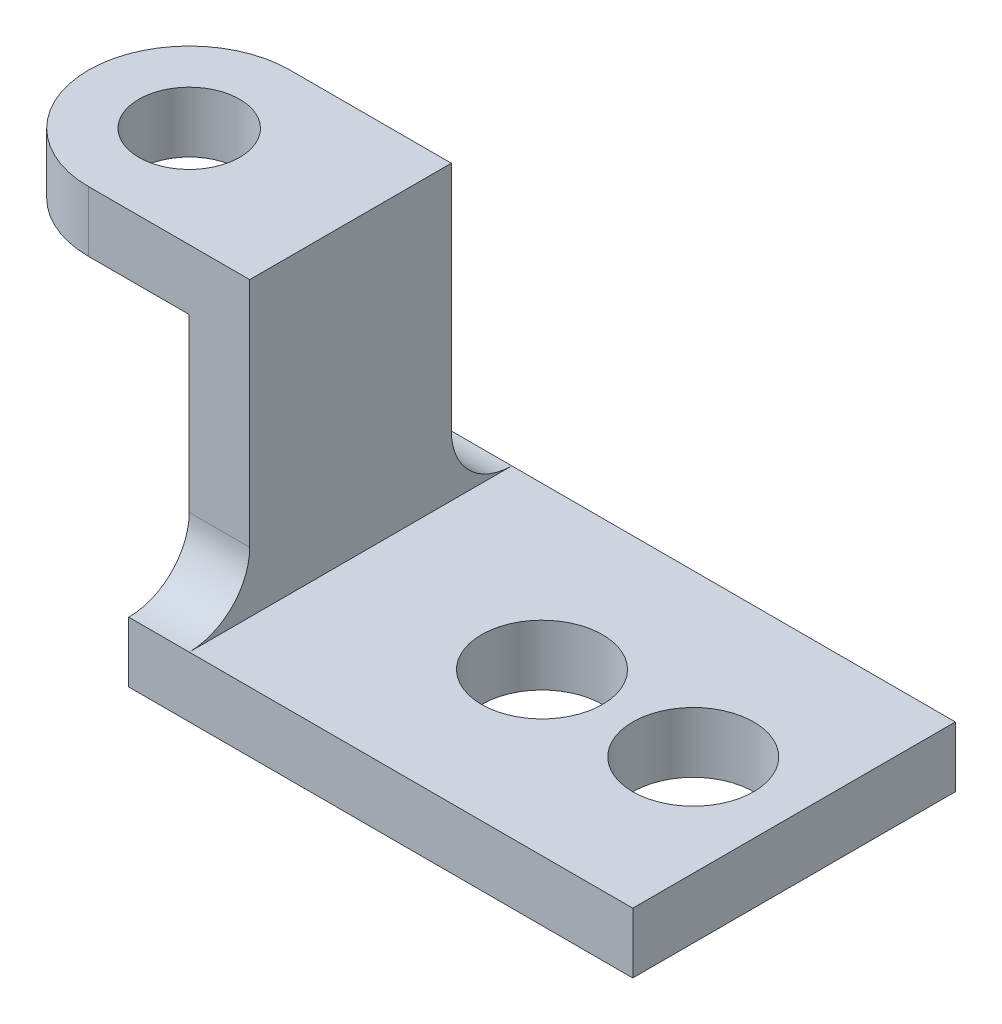
from build123d import *

# Parameters (mm, degrees)
SKETCH1_W               = 100
SKETCH1_H               = 64
BOSS_EXTRUDE1_DEPTH     = 12
CUT_EXTRUDE1_DEPTH      = 61.564015719
CUT_EXTRUDE1_DEPTH_BACK = 61.564015719
SKETCH2_R               = 12
SKETCH3_W               = 12
SKETCH3_H               = 40
BOSS_EXTRUDE2_DEPTH     = 46
SKETCH4_R               = 10
BOSS_EXTRUDE3_DEPTH     = 12
FILLET1_R               = 12


with BuildPart() as part:
    # Sketch1 → Boss-Extrude1 (new body)
    with BuildSketch(Plane(origin=(0, 0, 0), x_dir=(1, 0, 0), z_dir=(0, 1, 0))):
        Rectangle(SKETCH1_W, SKETCH1_H)
    extrude(amount=BOSS_EXTRUDE1_DEPTH)

    # Sketch2 → Cut-Extrude1 (cut, two sides: drawn at the far end of the back side and taken through both)
    with BuildSketch(Plane(origin=(0, 12, 0), x_dir=(1, 0, 0), z_dir=(0, 1, 0)).offset(-CUT_EXTRUDE1_DEPTH_BACK)):
        with Locations(Location((0, 0, 0), (0, 0, 270))):
            Circle(SKETCH2_R)
        with Locations(Location((30, 0, 0), (0, 0, 270))):
            Circle(SKETCH2_R)
    extrude(amount=CUT_EXTRUDE1_DEPTH + CUT_EXTRUDE1_DEPTH_BACK, mode=Mode.SUBTRACT)

    # Sketch3 → Boss-Extrude2 (add)
    with BuildSketch(Plane(origin=(0, 12, 0), x_dir=(1, 0, 0), z_dir=(0, 1, 0))):
        with Locations((-44, 0)):
            Rectangle(SKETCH3_W, SKETCH3_H)
    extrude(amount=BOSS_EXTRUDE2_DEPTH)

    # Sketch4 → Boss-Extrude3 (add)
    with BuildSketch(Plane(origin=(0, 58, 0), x_dir=(1, 0, 0), z_dir=(0, 1, 0))):
        with BuildLine():
            Line((-50, 20), (-70, 20))
            ThreePointArc((-70, 20), (-90, 0), (-70, -20))
            Line((-70, -20), (-50, -20))
            Line((-50, -20), (-38, -20))
            Line((-38, -20), (-38, 20))
            Line((-38, 20), (-50, 20))
        make_face()
        with Locations(Location((-70, 0, 0), (0, 0, 270))):
            Circle(SKETCH4_R, mode=Mode.SUBTRACT)
    extrude(amount=BOSS_EXTRUDE3_DEPTH)

    # Fillet1
    fillet1_edges = [part.edges().sort_by_distance(p)[0] for p in [
        (-44, 12, -20),
        (-44, 12, 20),
    ]]
    fillet(fillet1_edges, radius=FILLET1_R - 0.0001)  # a hair under: the kernel refuses the full size


solid = part.part
